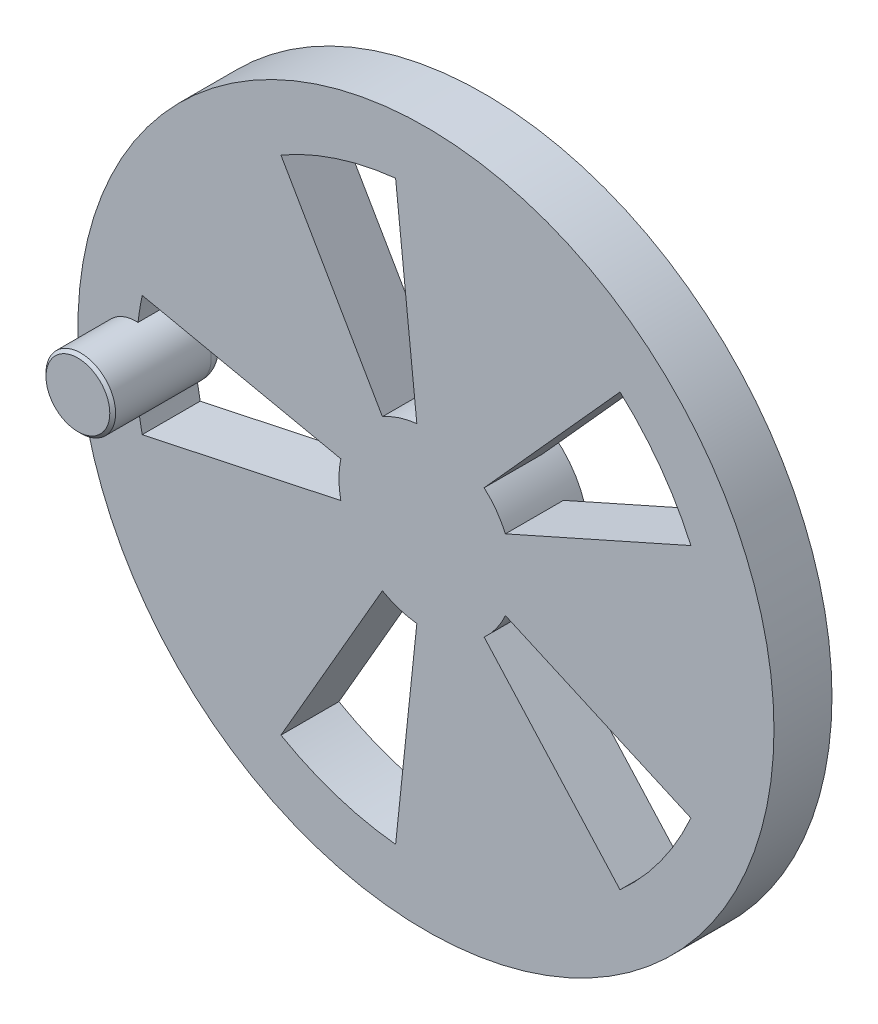
from build123d import *
from build123d.topology import SkipClean

# Parameters (mm, degrees)
SKETCH1_R           = 60
BOSS_EXTRUDE1_DEPTH = 10
SKETCH1_3_R         = 6
BOSS_EXTRUDE2_DEPTH = 10
CUT_EXTRUDE1_START  = -10
CUT_EXTRUDE1_DEPTH  = 10
BOSS_EXTRUDE4_START = 3
SKETCH3_R           = 15
SKETCH3_R_2         = 10
BOSS_EXTRUDE4_DEPTH = 3
FILLET1_R           = 3
CHAMFER1_SIZE       = 0.5


with BuildPart() as part:
    # Sketch1 → Boss-Extrude1 (new body)
    with BuildSketch(Plane.XY):
        Circle(SKETCH1_R)
    extrude(amount=-BOSS_EXTRUDE1_DEPTH)

    # Sketch1<3> → Boss-Extrude2 (add)
    with BuildSketch(Plane.XY):
        with Locations((-50, 0)):
            Circle(SKETCH1_3_R)
    extrude(amount=BOSS_EXTRUDE2_DEPTH)

    # Sketch2 → Cut-Extrude1 (cut)
    with SkipClean():  # the faces are left unmerged after this step: merging them gives an invalid solid
        with BuildSketch(Plane.XY.offset(CUT_EXTRUDE1_START)):
            with BuildLine():
                ThreePointArc((-14.672214011, -3.118675362), (-14.917828431, -1.567926949), (-15, 0))
                Line((-15, 0), (-44, 0))
                ThreePointArc((-44, 0), (-45.631934066, -4.11339276), (-49.64, -5.989190262))
                ThreePointArc((-49.64, -5.989190262), (-49.322921706, -8.200572806), (-48.907380037, -10.395584541))
                Line((-48.907380037, -10.395584541), (-14.672214011, -3.118675362))
            make_face()
            with BuildLine():
                Line((-44, 0), (-15, 0))
                ThreePointArc((-15, 0), (-14.917828431, 1.567926949), (-14.672214011, 3.118675362))
                Line((-14.672214011, 3.118675362), (-48.907380037, 10.395584541))
                ThreePointArc((-48.907380037, 10.395584541), (-49.322921706, 8.200572806), (-49.64, 5.989190262))
                ThreePointArc((-49.64, 5.989190262), (-45.631934066, 4.11339276), (-44, 0))
            make_face()
            with BuildLine():
                Line((-25, 43.301270189), (-7.5, 12.990381057))
                ThreePointArc((-7.5, 12.990381057), (-4.635254916, 14.265847744), (-1.567926949, 14.917828431))
                Line((-1.567926949, 14.917828431), (-5.226423163, 49.726094768))
                ThreePointArc((-5.226423163, 49.726094768), (-15.450849719, 47.552825815), (-25, 43.301270189))
            make_face()
            with BuildLine():
                ThreePointArc((10.036959095, 11.147172382), (12.135254916, 8.816778784), (13.703181865, 6.101049646))
                Line((13.703181865, 6.101049646), (45.677272882, 20.336832154))
                ThreePointArc((45.677272882, 20.336832154), (40.450849719, 29.389262615), (33.456530318, 37.157241274))
                Line((33.456530318, 37.157241274), (10.036959095, 11.147172382))
            make_face()
            with BuildLine():
                ThreePointArc((13.703181865, -6.101049646), (12.135254916, -8.816778784), (10.036959095, -11.147172382))
                Line((10.036959095, -11.147172382), (33.456530318, -37.157241274))
                ThreePointArc((33.456530318, -37.157241274), (40.450849719, -29.389262615), (45.677272882, -20.336832154))
                Line((45.677272882, -20.336832154), (13.703181865, -6.101049646))
            make_face()
            with BuildLine():
                ThreePointArc((-1.567926949, -14.917828431), (-4.635254916, -14.265847744), (-7.5, -12.990381057))
                Line((-7.5, -12.990381057), (-25, -43.301270189))
                ThreePointArc((-25, -43.301270189), (-15.450849719, -47.552825815), (-5.226423163, -49.726094768))
                Line((-5.226423163, -49.726094768), (-1.567926949, -14.917828431))
            make_face()
        extrude(amount=CUT_EXTRUDE1_DEPTH, mode=Mode.SUBTRACT)

    # Sketch3 → Boss-Extrude4 (add)
    with SkipClean():  # the faces are left unmerged after this step: merging them gives an invalid solid
        with BuildSketch(Plane(origin=(0, 0, -10), x_dir=(-1, 0, 0), z_dir=(0, 0, -1)).offset(BOSS_EXTRUDE4_START)):
            with Locations(Location((0, 0, 0), (0, 0, 156))):
                Circle(SKETCH3_R)
            Circle(SKETCH3_R_2, mode=Mode.SUBTRACT)
        extrude(amount=-BOSS_EXTRUDE4_DEPTH)

    # Fillet1
    # the kernel refuses this fillet: 3 mm, written as the material it takes off along each edge
    with BuildSketch(Plane(origin=(-50, 0, -10), x_dir=(-0.9290450691294319, 0.3699665654167807, 0), z_dir=(-0.3699665654167807, -0.9290450691294319, 0))) as fillet1_piece_1_section:
        with BuildLine():
            CenterArc((6 - FILLET1_R, -FILLET1_R), FILLET1_R, 0, 90)
            Line((6, -FILLET1_R), (6, 0))
            Line((6, 0), (6 - FILLET1_R, 0))
        make_face()
    fillet1_piece_1 = revolve(axis=Axis((-50, 0, -10), (0, 0, -1)), revolution_arc=316.572889398, mode=Mode.PRIVATE)
    fillet1_piece_1 = fillet1_piece_1 & Plane(origin=(0, 0, -9.144891987), x_dir=(-0.9928000000000012, -0.1197838052492802, 0), z_dir=(0, 0, -1)) * Cylinder(50, 24, mode=Mode.PRIVATE)
    add(fillet1_piece_1, mode=Mode.SUBTRACT)

    # Chamfer1
    chamfer1_edges = [part.edges().sort_by_distance(p)[0] for p in [
        (-56, 0, 10),
    ]]
    chamfer(chamfer1_edges, length=CHAMFER1_SIZE)


solid = part.part
